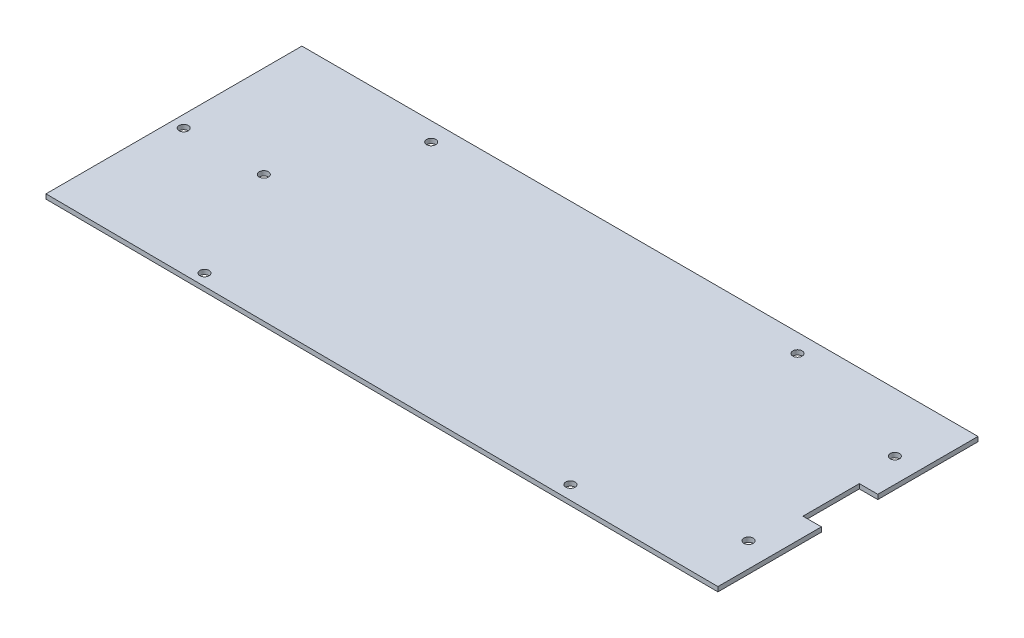
from build123d import *

# Parameters (mm, degrees)
SKETCH1_R           = 3
BOSS_EXTRUDE1_DEPTH = 3


with BuildPart() as part:
    # Sketch1 → Boss-Extrude1 (new body)
    with BuildSketch(Plane(origin=(0, 0, 0), x_dir=(1, 0, 0), z_dir=(0, 1, 0))):
        Polygon((56.000702368, -497.980368051), (495.333522728, -497.980368051), (495.333522728, -563.091000236), (483.333522728, -563.091000236), (483.333522728, -599.726550428), (495.333522728, -599.726550428), (495.333522728, -666.983518005), (56.000702368, -664.256774185), align=None)
        with Locations((63.795566368, -582.563569341)):
            Circle(SKETCH1_R, mode=Mode.SUBTRACT)
        with Locations((115.846397689, -582.563569341)):
            Circle(SKETCH1_R, mode=Mode.SUBTRACT)
        with Locations((152.014490623, -509.955660754)):
            Circle(SKETCH1_R, mode=Mode.SUBTRACT)
        with Locations((152.113129711, -657.377281332)):
            Circle(SKETCH1_R, mode=Mode.SUBTRACT)
        with Locations((390.014490623, -657.493569341)):
            Circle(SKETCH1_R, mode=Mode.SUBTRACT)
        with Locations((479.47492472, -631.223569341)):
            Circle(SKETCH1_R, mode=Mode.SUBTRACT)
        with Locations((479.422490623, -536.117660754)):
            Circle(SKETCH1_R, mode=Mode.SUBTRACT)
        with Locations((390.014490623, -509.955660754)):
            Circle(SKETCH1_R, mode=Mode.SUBTRACT)
    extrude(amount=BOSS_EXTRUDE1_DEPTH)


solid = part.part
